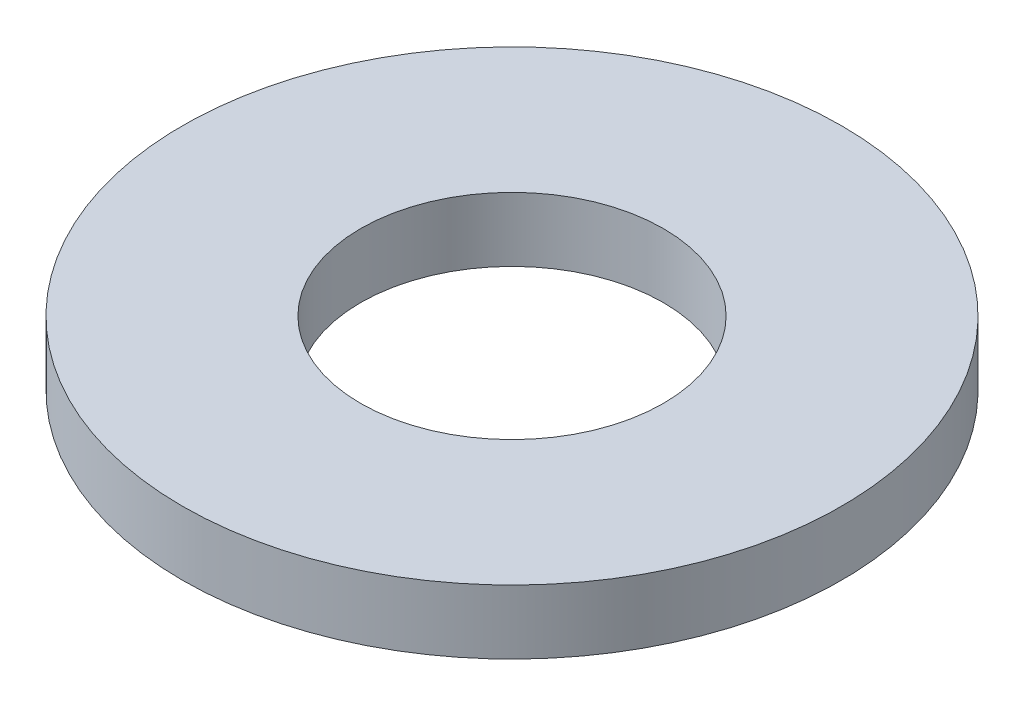
from build123d import *

# Parameters (mm, degrees)
SKETCH1_R           = 92.5
BOSS_EXTRUDE1_DEPTH = 18
SKETCH2_R           = 42.5
CUT_EXTRUDE1_DEPTH  = 133.047339996


with BuildPart() as part:
    # Sketch1 → Boss-Extrude1 (new body)
    with BuildSketch(Plane(origin=(0, 0, 0), x_dir=(1, 0, 0), z_dir=(0, 1, 0))):
        Circle(SKETCH1_R)
    extrude(amount=BOSS_EXTRUDE1_DEPTH)

    # Sketch2 → Cut-Extrude1 (cut, through all)
    with BuildSketch(Plane(origin=(0, 0, 0), x_dir=(1, 0, 0), z_dir=(0, 1, 0))):
        Circle(SKETCH2_R)
    extrude(amount=CUT_EXTRUDE1_DEPTH, mode=Mode.SUBTRACT)


solid = part.part
